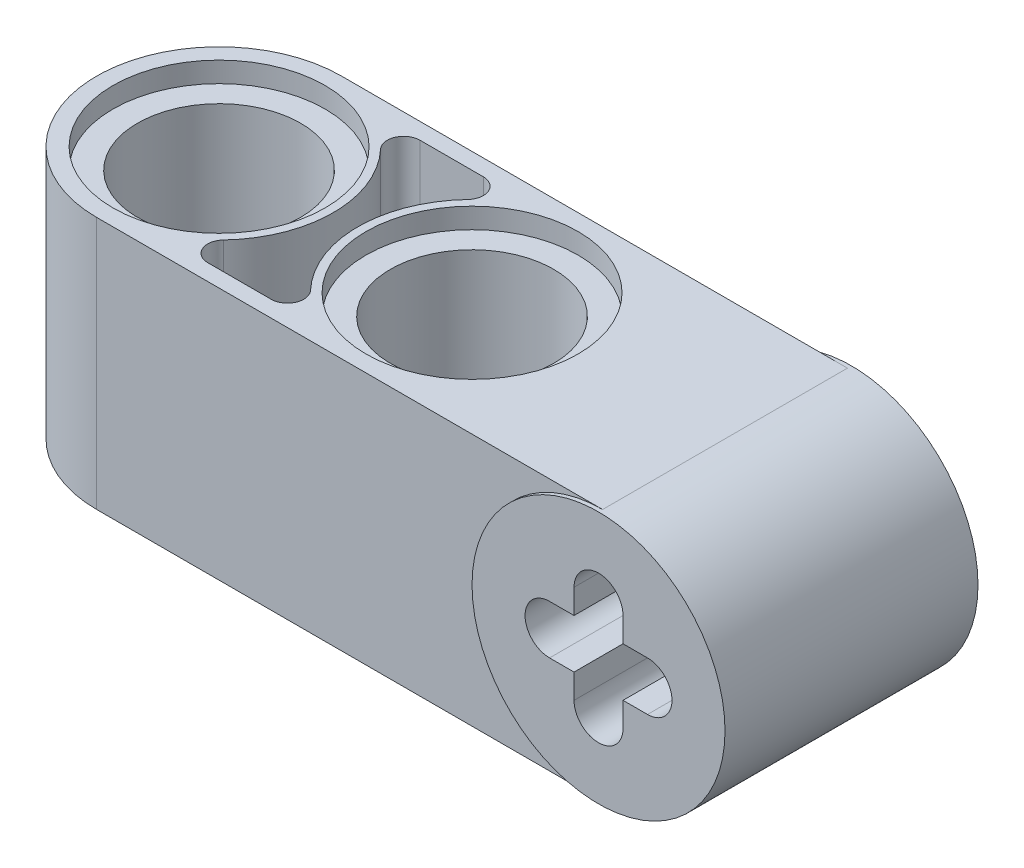
from build123d import *
from build123d.topology import SkipClean

# Parameters (mm, degrees)
SKETCH1_R                   = 3.429
SKETCH1_R_2                 = 2.54
BOSS_EXTRUDE1_DEPTH         = 3.81
TWOSTRAIGHT_START           = -0.623499004
TWOSTRAIGHT_OUTLINE_R       = 2.54
TWOSTRAIGHT_DEPTH           = 6.604
TWOSTRAIGHT_START_2         = -1.258499004
TWOSTRAIGHT_2_OUTLINE_R     = 3.302
TWOSTRAIGHT_2_DEPTH         = 7.874
BODY_MOVE_COPY3_START       = -4.724057793
BODY_MOVE_COPY3_OUTLINE_R   = 2.54
BODY_MOVE_COPY3_DEPTH       = 7.62
BODY_MOVE_COPY3_2_OUTLINE_R = 2.54
BODY_MOVE_COPY3_2_DEPTH     = 0.787057793
BODY_MOVE_COPY3_START_2     = -3.937
BODY_MOVE_COPY3_3_OUTLINE_R = 2.54
BODY_MOVE_COPY3_3_DEPTH     = 0.635
BODY_MOVE_COPY3_START_3     = -3.302
BODY_MOVE_COPY3_4_OUTLINE_R = 2.54
BODY_MOVE_COPY3_4_DEPTH     = 6.604
BODY_MOVE_COPY3_5_OUTLINE_R = 3.302
BODY_MOVE_COPY3_5_DEPTH     = 7.874
BOSS_EXTRUDE2_DEPTH         = 7.874
BOSS_EXTRUDE3_DEPTH         = 7.874
SKETCH4_R                   = 3.937
BOSS_EXTRUDE4_DEPTH         = 0.127


# Read off the part's stored shape, not the designer's step: TwoStraight, Body-Move/Copy3
with BuildPart() as part:
    # Sketch1 → Boss-Extrude1 (new body)
    # profile 1 of 3: a face of its own
    with BuildSketch(Plane.XY):
        with BuildLine():
            Line((3.937, -3.937), (8.001, -3.937))
            ThreePointArc((8.001, -3.937), (11.938, 0), (8.001, 3.937))
            Line((8.001, 3.937), (3.937, 3.937))
            Line((3.937, 3.937), (3.937, -3.937))
        make_face()
        with Locations((8.001, 0)):
            Circle(SKETCH1_R, mode=Mode.SUBTRACT)
    # profile 2 of 3: a face of its own
    with BuildSketch(Plane.XY):
        with Locations((8.001, 0)):
            Circle(SKETCH1_R)
        with Locations((8.001, 0)):
            Circle(SKETCH1_R_2, mode=Mode.SUBTRACT)
    # profile 3 of 3: a face of its own
    with BuildSketch(Plane.XY):
        with Locations((8.001, 0)):
            Circle(SKETCH1_R_2)
        with BuildLine():
            ThreePointArc((6.477, -0.762), (5.715, 0), (6.477, 0.762))
            Line((6.477, 0.762), (7.239, 0.762))
            Line((7.239, 0.762), (7.239, 1.524))
            ThreePointArc((7.239, 1.524), (8.001, 2.286), (8.763, 1.524))
            Line((8.763, 1.524), (8.763, 0.762))
            Line((8.763, 0.762), (9.525, 0.762))
            ThreePointArc((9.525, 0.762), (10.287, 0), (9.525, -0.762))
            Line((9.525, -0.762), (8.763, -0.762))
            Line((8.763, -0.762), (8.763, -1.524))
            ThreePointArc((8.763, -1.524), (8.001, -2.286), (7.239, -1.524))
            Line((7.239, -1.524), (7.239, -0.762))
            Line((7.239, -0.762), (6.477, -0.762))
        make_face(mode=Mode.SUBTRACT)
    extrude(amount=BOSS_EXTRUDE1_DEPTH)

    # Mirror1: part across plane


with BuildPart() as part_1:
    add(part.part)
    add(part.part.mirror(Plane(origin=(7.9375, -8.872950752, 3.81), x_dir=(1, 0, 0), z_dir=(0, 0, 1))))



with BuildPart() as body_2:
    # TwoStraight outline → TwoStraight (new body)
    with BuildSketch(Plane.XY.offset(TWOSTRAIGHT_START)):
        with BuildLine():
            ThreePointArc((-13.491428018, 2.895942207), (-17.301428018, -0.914057793), (-13.491428018, -4.724057793))
            Line((-13.491428018, -4.724057793), (-5.617428018, -4.724057793))
            ThreePointArc((-5.617428018, -4.724057793), (-1.807428018, -0.914057793), (-5.617428018, 2.895942207))
            Line((-5.617428018, 2.895942207), (-13.491428018, 2.895942207))
        make_face()
        with BuildLine():
            Line((-10.540214708, 2.387942207), (-8.568641328, 2.387942207))
            ThreePointArc((-8.568641328, 2.387942207), (-8.102013532, 2.080746839), (-8.199739664, 1.530692207))
            ThreePointArc((-8.199739664, 1.530692207), (-9.173428018, -0.914057793), (-8.199739664, -3.358807793))
            ThreePointArc((-8.199739664, -3.358807793), (-8.102013532, -3.908862424), (-8.568641328, -4.216057793))
            Line((-8.568641328, -4.216057793), (-10.540214708, -4.216057793))
            ThreePointArc((-10.540214708, -4.216057793), (-11.006842504, -3.908862424), (-10.909116372, -3.358807793))
            ThreePointArc((-10.909116372, -3.358807793), (-9.935428018, -0.914057793), (-10.909116372, 1.530692207))
            ThreePointArc((-10.909116372, 1.530692207), (-11.006842504, 2.080746839), (-10.540214708, 2.387942207))
        make_face(mode=Mode.SUBTRACT)
        with Locations((-13.491428018, -0.914057793)):
            Circle(TWOSTRAIGHT_OUTLINE_R, mode=Mode.SUBTRACT)
        with Locations((-5.617428018, -0.914057793)):
            Circle(TWOSTRAIGHT_OUTLINE_R, mode=Mode.SUBTRACT)
    extrude(amount=TWOSTRAIGHT_DEPTH)

    # TwoStraight 2 outline → TwoStraight 2 (add)
    with BuildSketch(Plane.XY.offset(TWOSTRAIGHT_START_2)):
        with BuildLine():
            ThreePointArc((-13.491428018, 2.895942207), (-17.301428018, -0.914057793), (-13.491428018, -4.724057793))
            Line((-13.491428018, -4.724057793), (-5.617428018, -4.724057793))
            ThreePointArc((-5.617428018, -4.724057793), (-1.807428018, -0.914057793), (-5.617428018, 2.895942207))
            Line((-5.617428018, 2.895942207), (-13.491428018, 2.895942207))
        make_face()
        with Locations((-13.491428018, -0.914057793)):
            Circle(TWOSTRAIGHT_2_OUTLINE_R, mode=Mode.SUBTRACT)
        with BuildLine():
            Line((-10.540214708, 2.387942207), (-8.568641328, 2.387942207))
            ThreePointArc((-8.568641328, 2.387942207), (-8.102013532, 2.080746839), (-8.199739664, 1.530692207))
            ThreePointArc((-8.199739664, 1.530692207), (-9.173428018, -0.914057793), (-8.199739664, -3.358807793))
            ThreePointArc((-8.199739664, -3.358807793), (-8.102013532, -3.908862424), (-8.568641328, -4.216057793))
            Line((-8.568641328, -4.216057793), (-10.540214708, -4.216057793))
            ThreePointArc((-10.540214708, -4.216057793), (-11.006842504, -3.908862424), (-10.909116372, -3.358807793))
            ThreePointArc((-10.909116372, -3.358807793), (-9.935428018, -0.914057793), (-10.909116372, 1.530692207))
            ThreePointArc((-10.909116372, 1.530692207), (-11.006842504, 2.080746839), (-10.540214708, 2.387942207))
        make_face(mode=Mode.SUBTRACT)
        with Locations((-5.617428018, -0.914057793)):
            Circle(TWOSTRAIGHT_2_OUTLINE_R, mode=Mode.SUBTRACT)
    extrude(amount=TWOSTRAIGHT_2_DEPTH)

    # Body-Move/Copy3 outline → Body-Move/Copy3 (cut)
    with BuildSketch(Plane(origin=(0, 0, 0), x_dir=(1, 0, 0), z_dir=(0, 1, 0)).offset(BODY_MOVE_COPY3_START)):
        with BuildLine():
            Line((-7.747, 0), (0.127, 0))
            ThreePointArc((0.127, 0), (3.502330265, -2.042729335), (3.258297722, -5.980500996))
            Line((3.258297722, -5.980500996), (5, -5.980500996))
            Line((5, -5.980500996), (5, 1.258499004))
            Line((5, 1.258499004), (-19, 1.258499004))
            Line((-19, 1.258499004), (-19, -6.615500996))
            Line((-19, -6.615500996), (-10.324840988, -6.615500996))
            ThreePointArc((-10.324840988, -6.615500996), (-11.29700414, -2.426681308), (-7.747, 0))
        make_face()
        with BuildLine():
            Line((-1.192289743, -5.980500996), (1.446289743, -5.980500996))
            ThreePointArc((1.446289743, -5.980500996), (0.127, -1.27), (-1.192289743, -5.980500996))
        make_face()
        with Locations((-7.747, -3.81)):
            Circle(BODY_MOVE_COPY3_OUTLINE_R)
        with BuildLine():
            ThreePointArc((-5.164688354, -6.25475), (-5.269830324, -6.421389396), (-5.303656483, -6.615500996))
            Line((-5.303656483, -6.615500996), (-2.316343517, -6.615500996))
            ThreePointArc((-2.316343517, -6.615500996), (-2.350169676, -6.421389396), (-2.455311646, -6.25475))
            ThreePointArc((-2.455311646, -6.25475), (-3.429, -3.81), (-2.455311646, -1.36525))
            ThreePointArc((-2.455311646, -1.36525), (-2.357585514, -0.815195369), (-2.82421331, -0.508))
            Line((-2.82421331, -0.508), (-4.79578669, -0.508))
            ThreePointArc((-4.79578669, -0.508), (-5.262414486, -0.815195369), (-5.164688354, -1.36525))
            ThreePointArc((-5.164688354, -1.36525), (-4.191, -3.81), (-5.164688354, -6.25475))
        make_face()
    extrude(amount=BODY_MOVE_COPY3_DEPTH, mode=Mode.SUBTRACT)

    # Body-Move_Copy3 2 outline → Body-Move_Copy3 2 (cut)
    with BuildSketch(Plane(origin=(0, 0, 0), x_dir=(1, 0, 0), z_dir=(0, 1, 0)).offset(BODY_MOVE_COPY3_START)):
        with BuildLine():
            Line((0.127, 0), (-7.747, 0))
            ThreePointArc((-7.747, 0), (-11.29700414, -2.426681308), (-10.324840988, -6.615500996))
            Line((-10.324840988, -6.615500996), (-5.303656483, -6.615500996))
            ThreePointArc((-5.303656483, -6.615500996), (-5.269830324, -6.421389396), (-5.164688354, -6.25475))
            ThreePointArc((-5.164688354, -6.25475), (-4.191, -3.81), (-5.164688354, -1.36525))
            ThreePointArc((-5.164688354, -1.36525), (-5.262414486, -0.815195369), (-4.79578669, -0.508))
            Line((-4.79578669, -0.508), (-2.82421331, -0.508))
            ThreePointArc((-2.82421331, -0.508), (-2.357585514, -0.815195369), (-2.455311646, -1.36525))
            ThreePointArc((-2.455311646, -1.36525), (-3.424421255, -3.629603031), (-2.689746603, -5.980500996))
            Line((-2.689746603, -5.980500996), (-2.361398968, -5.980500996))
            ThreePointArc((-2.361398968, -5.980500996), (0.127, -0.508), (2.615398968, -5.980500996))
            Line((2.615398968, -5.980500996), (3.258297722, -5.980500996))
            ThreePointArc((3.258297722, -5.980500996), (3.502330265, -2.042729335), (0.127, 0))
        make_face()
        with Locations((-7.747, -3.81)):
            Circle(BODY_MOVE_COPY3_2_OUTLINE_R, mode=Mode.SUBTRACT)
    extrude(amount=BODY_MOVE_COPY3_2_DEPTH, mode=Mode.SUBTRACT)

    # Body-Move_Copy3 3 outline → Body-Move_Copy3 3 (cut)
    # profile 1 of 2: a face of its own
    with BuildSketch(Plane(origin=(0, 0, 0), x_dir=(1, 0, 0), z_dir=(0, 1, 0)).offset(BODY_MOVE_COPY3_START_2)):
        with BuildLine():
            ThreePointArc((-6.005630378, -6.615500996), (-7.747, -0.508), (-9.488369622, -6.615500996))
            Line((-9.488369622, -6.615500996), (-6.005630378, -6.615500996))
        make_face()
        with Locations((-7.747, -3.81)):
            Circle(BODY_MOVE_COPY3_3_OUTLINE_R, mode=Mode.SUBTRACT)
    # profile 2 of 2: a face of its own
    with BuildSketch(Plane(origin=(0, 0, 0), x_dir=(1, 0, 0), z_dir=(0, 1, 0)).offset(BODY_MOVE_COPY3_START_2)):
        with BuildLine():
            Line((1.446289743, -5.980500996), (2.615398968, -5.980500996))
            ThreePointArc((2.615398968, -5.980500996), (0.127, -0.508), (-2.361398968, -5.980500996))
            Line((-2.361398968, -5.980500996), (-1.192289743, -5.980500996))
            ThreePointArc((-1.192289743, -5.980500996), (0.127, -1.27), (1.446289743, -5.980500996))
        make_face()
    extrude(amount=BODY_MOVE_COPY3_3_DEPTH, mode=Mode.SUBTRACT)

    # Body-Move_Copy3 4 outline → Body-Move_Copy3 4 (add)
    with SkipClean():  # the faces are left unmerged after this step: merging them gives an invalid solid
        with BuildSketch(Plane(origin=(0, 0, 0), x_dir=(1, 0, 0), z_dir=(0, 1, 0)).offset(BODY_MOVE_COPY3_START_3)):
            with BuildLine():
                Line((0.127, 0), (-7.747, 0))
                ThreePointArc((-7.747, 0), (-11.557, -3.81), (-7.747, -7.62))
                Line((-7.747, -7.62), (0.127, -7.62))
                ThreePointArc((0.127, -7.62), (3.937, -3.81), (0.127, 0))
            make_face()
            with BuildLine():
                ThreePointArc((-2.455311646, -1.36525), (-3.429, -3.81), (-2.455311646, -6.25475))
                ThreePointArc((-2.455311646, -6.25475), (-2.357585514, -6.804804631), (-2.82421331, -7.112))
                Line((-2.82421331, -7.112), (-4.79578669, -7.112))
                ThreePointArc((-4.79578669, -7.112), (-5.262414486, -6.804804631), (-5.164688354, -6.25475))
                ThreePointArc((-5.164688354, -6.25475), (-4.191, -3.81), (-5.164688354, -1.36525))
                ThreePointArc((-5.164688354, -1.36525), (-5.262414486, -0.815195369), (-4.79578669, -0.508))
                Line((-4.79578669, -0.508), (-2.82421331, -0.508))
                ThreePointArc((-2.82421331, -0.508), (-2.357585514, -0.815195369), (-2.455311646, -1.36525))
            make_face(mode=Mode.SUBTRACT)
            with Locations((0.127, -3.81)):
                Circle(BODY_MOVE_COPY3_4_OUTLINE_R, mode=Mode.SUBTRACT)
            with Locations((-7.747, -3.81)):
                Circle(BODY_MOVE_COPY3_4_OUTLINE_R, mode=Mode.SUBTRACT)
        extrude(amount=BODY_MOVE_COPY3_4_DEPTH)

    # Body-Move_Copy3 5 outline → Body-Move_Copy3 5 (add)
    with SkipClean():  # the faces are left unmerged after this step: merging them gives an invalid solid
        with BuildSketch(Plane(origin=(0, 0, 0), x_dir=(1, 0, 0), z_dir=(0, 1, 0)).offset(BODY_MOVE_COPY3_START_2)):
            with BuildLine():
                Line((0.127, 0), (-7.747, 0))
                ThreePointArc((-7.747, 0), (-11.557, -3.81), (-7.747, -7.62))
                Line((-7.747, -7.62), (0.127, -7.62))
                ThreePointArc((0.127, -7.62), (3.937, -3.81), (0.127, 0))
            make_face()
            with Locations((0.127, -3.81)):
                Circle(BODY_MOVE_COPY3_5_OUTLINE_R, mode=Mode.SUBTRACT)
            with BuildLine():
                ThreePointArc((-2.455311646, -1.36525), (-3.429, -3.81), (-2.455311646, -6.25475))
                ThreePointArc((-2.455311646, -6.25475), (-2.357585514, -6.804804631), (-2.82421331, -7.112))
                Line((-2.82421331, -7.112), (-4.79578669, -7.112))
                ThreePointArc((-4.79578669, -7.112), (-5.262414486, -6.804804631), (-5.164688354, -6.25475))
                ThreePointArc((-5.164688354, -6.25475), (-4.191, -3.81), (-5.164688354, -1.36525))
                ThreePointArc((-5.164688354, -1.36525), (-5.262414486, -0.815195369), (-4.79578669, -0.508))
                Line((-4.79578669, -0.508), (-2.82421331, -0.508))
                ThreePointArc((-2.82421331, -0.508), (-2.357585514, -0.815195369), (-2.455311646, -1.36525))
            make_face(mode=Mode.SUBTRACT)
            with Locations((-7.747, -3.81)):
                Circle(BODY_MOVE_COPY3_5_OUTLINE_R, mode=Mode.SUBTRACT)
        extrude(amount=BODY_MOVE_COPY3_5_DEPTH)


with BuildPart() as part_2:
    with SkipClean():  # the faces are left unmerged after this step: merging them gives an invalid solid
        add(part_1.part)

        add(body_2.part)  # Boss-Extrude2 merges body 2
        # Sketch2 → Boss-Extrude2 (add)
        with BuildSketch(Plane.XZ.offset(3.937)):
            with BuildLine():
                Line((3.937, 7.62), (3.937, 3.81))
                ThreePointArc((3.937, 3.81), (2.821076836, 6.504076836), (0.127, 7.62))
                Line((0.127, 7.62), (3.937, 7.62))
            make_face()
        extrude(amount=-BOSS_EXTRUDE2_DEPTH)

    # Sketch3 → Boss-Extrude3 (add)
    with SkipClean():  # the faces are left unmerged after this step: merging them gives an invalid solid
        with BuildSketch(Plane.XZ.offset(3.937)):
            with BuildLine():
                Line((3.937, 3.81), (3.937, 0))
                Line((3.937, 0), (0.127, 0))
                ThreePointArc((0.127, 0), (2.821076836, 1.115923164), (3.937, 3.81))
            make_face()
        extrude(amount=-BOSS_EXTRUDE3_DEPTH)

    # Sketch4 → Boss-Extrude4 (add)
    with SkipClean():  # the faces are left unmerged after this step: merging them gives an invalid solid
        with BuildSketch(Plane.XY.offset(7.62)):
            with Locations(Location((8.001, 0, 0), (0, 0, 90))):
                Circle(SKETCH4_R)
            with BuildLine():
                Line((6.477, 0.762), (7.239, 0.762))
                Line((7.239, 0.762), (7.239, 1.524))
                ThreePointArc((7.239, 1.524), (8.001, 2.286), (8.763, 1.524))
                Line((8.763, 1.524), (8.763, 0.762))
                Line((8.763, 0.762), (9.525, 0.762))
                ThreePointArc((9.525, 0.762), (10.287, 0), (9.525, -0.762))
                Line((9.525, -0.762), (8.763, -0.762))
                Line((8.763, -0.762), (8.763, -1.524))
                ThreePointArc((8.763, -1.524), (8.001, -2.286), (7.239, -1.524))
                Line((7.239, -1.524), (7.239, -0.762))
                Line((7.239, -0.762), (6.477, -0.762))
                ThreePointArc((6.477, -0.762), (5.715, 0), (6.477, 0.762))
            make_face(mode=Mode.SUBTRACT)
        boss_extrude4 = extrude(amount=BOSS_EXTRUDE4_DEPTH)

    # Mirror2: Boss-Extrude4 across plane
    with SkipClean():  # the faces are left unmerged after this step: merging them gives an invalid solid
        add(boss_extrude4.mirror(Plane.XY.offset(3.81)))


solid = part_2.part
